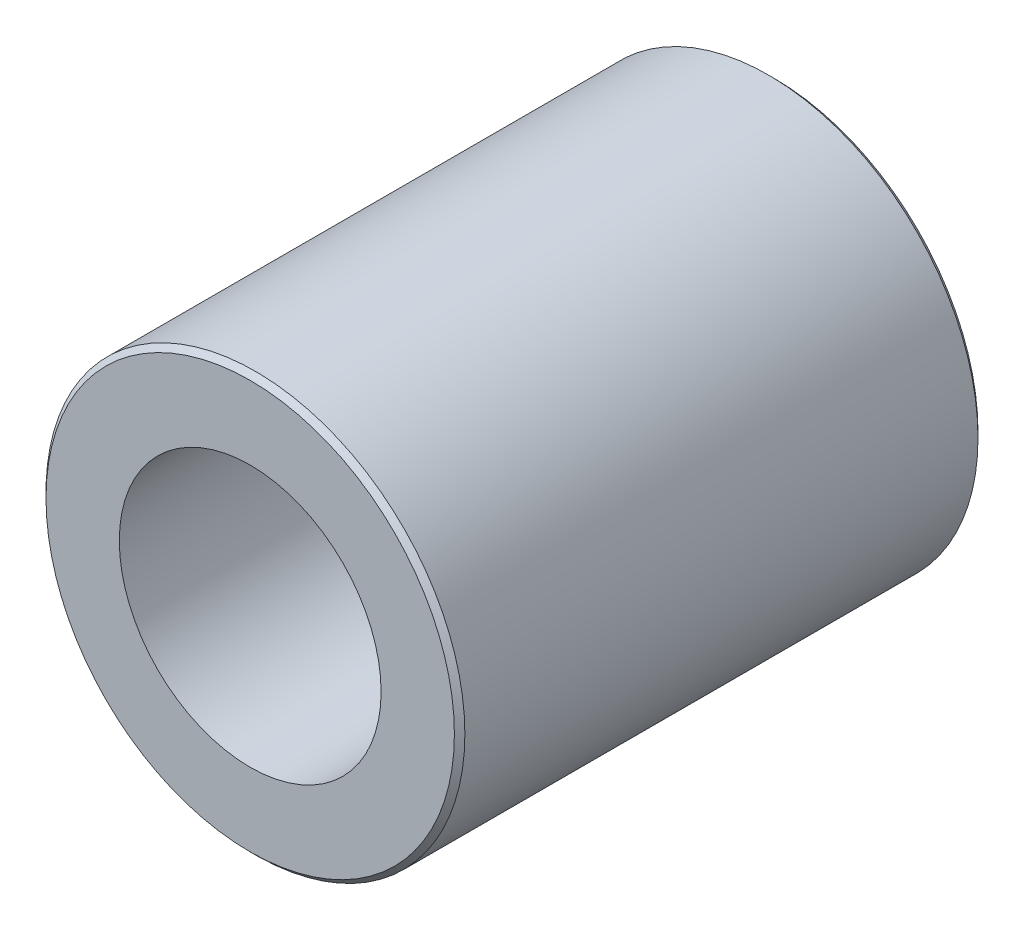
from build123d import *

# Parameters (mm, degrees)
ESQUISSE1_R              = 2
ESQUISSE1_R_2            = 1.06
EXTRUSION1_DEPTH         = 5
CHANFREIN1_SIZE          = 0.05
SUPPRIMERFACE1_OUTLINE_R = 1.06
SUPPRIMERFACE1_DEPTH     = 5
TROU_TARAUD_M31_D        = 2.5


# Read off the part's stored shape, not the designer's step: SupprimerFace1
with BuildPart() as part:
    # Esquisse1 → Extrusion1 (new body)
    with BuildSketch(Plane.XY):
        Circle(ESQUISSE1_R)
        Circle(ESQUISSE1_R_2, mode=Mode.SUBTRACT)
    extrude(amount=EXTRUSION1_DEPTH)

    # Chanfrein1
    chanfrein1_edges = [part.edges().sort_by_distance(p)[0] for p in [
        (-2, 0, 0),
        (-2, 0, 5),
    ]]
    chamfer(chanfrein1_edges, length=CHANFREIN1_SIZE)

    # SupprimerFace1 outline → SupprimerFace1 (add)
    with BuildSketch(Plane.XY):
        Circle(SUPPRIMERFACE1_OUTLINE_R)
    extrude(amount=SUPPRIMERFACE1_DEPTH)

    # Trou taraudé M31 (through all)
    with Locations(Plane(origin=(0, 0, 0), x_dir=(-1, 0, 0), z_dir=(0, 0, -1))):
        with Locations((0, 0)):
            Hole(TROU_TARAUD_M31_D / 2)


solid = part.part
